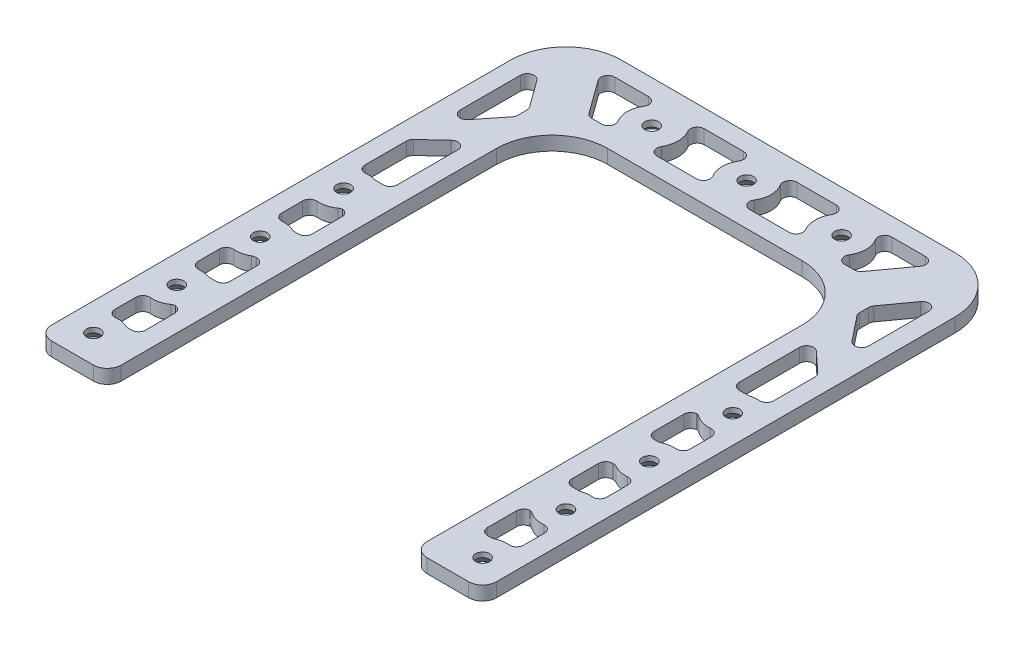
from build123d import *
from OCP.BRepFilletAPI import BRepFilletAPI_MakeChamfer

# Parameters (mm, degrees)
SKETCH1_R            = 3.175
BOSS_EXTRUDE1_DEPTH  = 6.35
SKETCH3_R            = 3.175
CUT_EXTRUDE1_DEPTH   = 6.35
FILLET4_R            = 3.175
FILLET4_OF_MIRROR1_R = 3.175
CHAMFER1_SIZE        = 4.0894
CHAMFER1_SIZE2       = 3.554861186


with BuildPart() as part:
    # Sketch1 → Boss-Extrude1 (new body)
    with BuildSketch(Plane(origin=(0, 0, 0), x_dir=(1, 0, 0), z_dir=(0, 1, 0))):
        with BuildLine():
            Line((-76.2, -114.3), (-95.25, -114.3))
            ThreePointArc((-95.25, -114.3), (-99.740128061, -112.440128061), (-101.6, -107.95))
            Line((-101.6, -107.95), (-101.6, 101.6))
            ThreePointArc((-101.6, 101.6), (-94.160512242, 119.560512242), (-76.2, 127))
            Line((-76.2, 127), (76.2, 127))
            ThreePointArc((76.2, 127), (94.160512242, 119.560512242), (101.6, 101.6))
            Line((101.6, 101.6), (101.6, -107.95))
            ThreePointArc((101.6, -107.95), (99.740128061, -112.440128061), (95.25, -114.3))
            Line((95.25, -114.3), (76.2, -114.3))
            ThreePointArc((76.2, -114.3), (71.709871939, -112.440128061), (69.85, -107.95))
            Line((69.85, -107.95), (69.85, 63.5))
            ThreePointArc((69.85, 63.5), (62.410512242, 81.460512242), (44.45, 88.9))
            Line((44.45, 88.9), (-44.45, 88.9))
            ThreePointArc((-44.45, 88.9), (-62.410512242, 81.460512242), (-69.85, 63.5))
            Line((-69.85, 63.5), (-69.85, -107.95))
            ThreePointArc((-69.85, -107.95), (-71.709871939, -112.440128061), (-76.2, -114.3))
        make_face()
        with Locations(Location((-88.9, -101.6, 0), (0, 0, 270))):
            Circle(SKETCH1_R, mode=Mode.SUBTRACT)
        with Locations(Location((-88.9, -63.5, 0), (0, 0, 270))):
            Circle(SKETCH1_R, mode=Mode.SUBTRACT)
        with Locations(Location((-88.9, -25.4, 0), (0, 0, 270))):
            Circle(SKETCH1_R, mode=Mode.SUBTRACT)
        with Locations(Location((-88.9, 12.7, 0), (0, 0, 270))):
            Circle(SKETCH1_R, mode=Mode.SUBTRACT)
        with Locations(Location((88.9, -101.6, 0), (0, 0, 270))):
            Circle(SKETCH1_R, mode=Mode.SUBTRACT)
        with Locations(Location((88.9, -63.5, 0), (0, 0, 270))):
            Circle(SKETCH1_R, mode=Mode.SUBTRACT)
        with Locations(Location((88.9, -25.4, 0), (0, 0, 270))):
            Circle(SKETCH1_R, mode=Mode.SUBTRACT)
        with Locations(Location((88.9, 12.7, 0), (0, 0, 270))):
            Circle(SKETCH1_R, mode=Mode.SUBTRACT)
    extrude(amount=BOSS_EXTRUDE1_DEPTH)

    # Sketch3 → Cut-Extrude1 (cut)
    with BuildSketch(Plane(origin=(0, 6.35, 0), x_dir=(1, 0, 0), z_dir=(0, 1, 0))):
        with Locations(Location((43.375353707, 107.95, 0), (0, 0, 270))):
            Circle(SKETCH3_R)
        with Locations(Location((0, 107.95, 0), (0, 0, 270))):
            Circle(SKETCH3_R)
        with BuildLine():
            Line((78.105, 23.258336745), (78.105, 61.340531918))
            Line((78.105, 61.340531918), (93.345, 47.170067796))
            Line((93.345, 47.170067796), (93.345, 22.884774482))
            ThreePointArc((93.345, 22.884774482), (89.424192912, 23.800129641), (85.434573413, 23.258336745))
            Line((85.434573413, 23.258336745), (78.105, 23.258336745))
        make_face()
        with BuildLine():
            Line((77.259672654, 118.745), (61.591199198, 97.155))
            Line((61.591199198, 97.155), (46.268613287, 97.155))
            ThreePointArc((46.268613287, 97.155), (54.551353707, 107.95), (46.268613287, 118.745))
            Line((46.268613287, 118.745), (77.259672654, 118.745))
        make_face()
        Polygon((93.345, 107.656756033), (78.105, 86.657160832), (78.105, 80.390531918), (93.345, 61.340531918), align=None)
        with BuildLine():
            Line((37.959659881, 118.745), (2.89325958, 118.745))
            ThreePointArc((2.89325958, 118.745), (11.176, 107.95), (2.89325958, 97.155))
            Line((2.89325958, 97.155), (37.959659881, 97.155))
            ThreePointArc((37.959659881, 97.155), (31.298029309, 107.95), (37.959659881, 118.745))
        make_face()
        with BuildLine():
            Line((78.105, 4.317675942), (78.105, -15.63042915))
            Line((78.105, -15.63042915), (83.604422444, -15.63042915))
            ThreePointArc((83.604422444, -15.63042915), (88.426746306, -14.297581921), (93.345, -15.215225518))
            Line((93.345, -15.215225518), (93.345, 2.515225518))
            ThreePointArc((93.345, 2.515225518), (87.21371935, 1.716188557), (81.604501413, 4.317675942))
            Line((81.604501413, 4.317675942), (78.105, 4.317675942))
        make_face()
        with BuildLine():
            Line((93.345, -35.584774482), (93.345, -53.315225518))
            ThreePointArc((93.345, -53.315225518), (89.184741981, -52.391148653), (84.982606187, -53.100880712))
            Line((84.982606187, -53.100880712), (78.105, -53.100880712))
            Line((78.105, -53.100880712), (78.105, -34.571089953))
            Line((78.105, -34.571089953), (82.62474978, -34.571089953))
            ThreePointArc((82.62474978, -34.571089953), (87.853891474, -36.463151143), (93.345, -35.584774482))
        make_face()
        with BuildLine():
            Line((81.791573677, -72.041541515), (78.105, -72.041541515))
            Line((78.105, -72.041541515), (78.105, -91.738428923))
            Line((78.105, -91.738428923), (83.641445836, -91.738428923))
            ThreePointArc((83.641445836, -91.738428923), (88.448367548, -90.43312917), (93.345, -91.345978789))
            Line((93.345, -91.345978789), (93.345, -73.684774482))
            ThreePointArc((93.345, -73.684774482), (87.335227304, -74.501779068), (81.791573677, -72.041541515))
        make_face()
    cut_extrude1 = extrude(amount=-CUT_EXTRUDE1_DEPTH, mode=Mode.SUBTRACT)

    # Fillet4
    # the kernel refuses this fillet: 3.175 mm, written as the material it adds along each edge
    with BuildSketch(Plane(origin=(93.345, 6.35, -107.656756033), x_dir=(0, 0, 1), z_dir=(0, -1, 0))) as fillet4_piece_1:
        with BuildLine():
            CenterArc((FILLET4_R * 3.08047739676, FILLET4_R), FILLET4_R, 125.969453218, 144.030546782)
            Line((FILLET4_R * 2.49312354886, FILLET4_R * 1.80933025235), (0, 0))
            Line((0, 0), (FILLET4_R * 3.08047739676, 0))
        make_face()
    extrude(amount=6.35)
    with BuildSketch(Plane(origin=(81.791573677, 6.35, 72.041541515), x_dir=(0.7950634404739595, 0, 0.6065262777668505), z_dir=(0, -1, 0))) as fillet4_piece_2:
        with BuildLine():
            CenterArc((1.076526873, 3.172147069), FILLET4_R, 232.661248168, 34.909660196)
            Line((-0.849194059, 0.647820646), (0, 0))
            ThreePointArc((0, 0), (0.470980507, 0.009985257), (0.941961014, 0))
        make_face()
    extrude(amount=6.35)
    with BuildSketch(Plane(origin=(93.345, 6.35, 35.584774482), x_dir=(0, 0, 1), z_dir=(0, -1, 0)), Plane(origin=(93.345, 6.35, -2.515225518), x_dir=(0, 0, 1), z_dir=(0, -1, 0))) as fillet4_piece_3:
        with BuildLine():
            CenterArc((4.046169136, 3.175), FILLET4_R, 174.900311086, 95.099688914)
            ThreePointArc((0.883737221, 3.457222222), (0.581545213, 1.692906894), (0, 0))
            Line((0, 0), (4.046169136, 0))
        make_face()
    extrude(amount=6.35)
    with BuildSketch(Plane(origin=(81.604501413, 6.35, -4.317675942), x_dir=(-1, 0, 0), z_dir=(0, -1, 0))) as fillet4_piece_4:
        with BuildLine():
            CenterArc((1.104555988, -3.175), FILLET4_R, 90, 36.010275214)
            ThreePointArc((-0.762122806, -0.606705765), (-0.374410194, -0.311707901), (0, 0))
            Line((0, 0), (1.104555988, 0))
        make_face()
    extrude(amount=6.35)
    with BuildSketch(Plane(origin=(78.105, 6.35, -4.317675942), x_dir=(0, 0, 1), z_dir=(0, -1, 0)), Plane(origin=(78.105, 6.35, 34.571089953), x_dir=(0, 0, 1), z_dir=(0, -1, 0)), Plane(origin=(78.105, 6.35, 53.100880712), x_dir=(1, 0, 0), z_dir=(0, -1, 0)), Plane(origin=(78.105, 6.35, 15.63042915), x_dir=(1, 0, 0), z_dir=(0, -1, 0)), Plane(origin=(78.105, 6.35, 91.738428923), x_dir=(1, 0, 0), z_dir=(0, -1, 0)), Plane(origin=(78.105, 6.35, 72.041541515), x_dir=(0, 0, 1), z_dir=(0, -1, 0))) as fillet4_piece_5:
        with BuildLine():
            CenterArc((FILLET4_R, -FILLET4_R), FILLET4_R, 90, 90)
            Line((0, -FILLET4_R), (0, 0))
            Line((0, 0), (FILLET4_R, 0))
        make_face()
    extrude(amount=6.35)
    with BuildSketch(Plane(origin=(82.62474978, 6.35, 34.571089953), x_dir=(-1, 0, 0), z_dir=(0, -1, 0))) as fillet4_piece_6:
        with BuildLine():
            CenterArc((0.915488207, -3.175), FILLET4_R, 90, 30.21782343)
            ThreePointArc((-0.682453666, -0.431424455), (-0.337307367, -0.221912279), (0, 0))
            Line((0, 0), (0.915488207, 0))
        make_face()
    extrude(amount=6.35)
    with BuildSketch(Plane(origin=(93.345, 6.35, 53.315225518), x_dir=(0, 0, -1), z_dir=(0, -1, 0)), Plane(origin=(93.345, 6.35, 15.215225518), x_dir=(0, 0, -1), z_dir=(0, -1, 0)), Plane(origin=(93.345, 6.35, -22.884774482), x_dir=(0, 0, -1), z_dir=(0, -1, 0))) as fillet4_piece_7:
        with BuildLine():
            CenterArc((4.046169136, -3.175), FILLET4_R, 90, 95.099688914)
            ThreePointArc((0.883737221, -3.457222222), (0.581545213, -1.692906894), (0, 0))
            Line((0, 0), (4.046169136, 0))
        make_face()
    extrude(amount=6.35)
    with BuildSketch(Plane(origin=(93.345, 6.35, -61.340531918), x_dir=(0, 0, -1), z_dir=(0, -1, 0))) as fillet4_piece_8:
        with BuildLine():
            CenterArc((FILLET4_R * 2.85078105936, -FILLET4_R), FILLET4_R, 90, 141.340191746)
            Line((FILLET4_R * 2.2260860118, -FILLET4_R * 1.78086880944), (0, 0))
            Line((0, 0), (FILLET4_R * 2.85078105936, 0))
        make_face()
    extrude(amount=6.35)
    with BuildSketch(Plane(origin=(84.982606187, 6.35, 53.100880712), x_dir=(0.9431539105174358, 0, -0.3323562863489553), z_dir=(0, -1, 0))) as fillet4_piece_9:
        with BuildLine():
            CenterArc((0.545126003, -3.174268709), FILLET4_R, 91.229756593, 18.182098439)
            Line((-0.510105206, -0.179755043), (0, 0))
            ThreePointArc((0, 0), (0.238492626, -0.002559518), (0.476985252, 0))
        make_face()
    extrude(amount=6.35)
    with BuildSketch(Plane(origin=(83.604422444, 6.35, 15.63042915), x_dir=(0.8929765434620884, 0, -0.4501032024175135), z_dir=(0, -1, 0))) as fillet4_piece_10:
        with BuildLine():
            CenterArc((0.757740379, -3.173586864), FILLET4_R, 91.709518425, 25.040787078)
            Line((-0.671337288, -0.338386339), (0, 0))
            ThreePointArc((0, 0), (0.331511416, -0.004945974), (0.663022832, 0))
        make_face()
    extrude(amount=6.35)
    with BuildSketch(Plane(origin=(85.434573413, 6.35, -23.258336745), x_dir=(0.9558423918856299, 0, -0.2938797745241371), z_dir=(0, -1, 0))) as fillet4_piece_11:
        with BuildLine():
            CenterArc((0.478902893, -3.174435609), FILLET4_R, 91.080344117, 16.010031791)
            Line((-0.454165391, -0.139636015), (0, 0))
            ThreePointArc((0, 0), (0.209520016, -0.001975367), (0.419040032, 0))
        make_face()
    extrude(amount=6.35)
    with BuildSketch(Plane(origin=(78.105, 6.35, -80.390531918), x_dir=(0.6246950475544321, 0, 0.7808688094430242), z_dir=(0, -1, 0))) as fillet4_piece_12:
        with BuildLine():
            CenterArc((FILLET4_R * 0.350781059358, -FILLET4_R), FILLET4_R, 90, 38.659808254)
            Line((-FILLET4_R * 0.273913988196, -FILLET4_R * 0.219131190557), (0, 0))
            Line((0, 0), (FILLET4_R * 0.350781059358, 0))
        make_face()
    extrude(amount=6.35)
    with BuildSketch(Plane(origin=(78.105, 6.35, -86.657160832), x_dir=(0, 0, 1), z_dir=(0, -1, 0))) as fillet4_piece_13:
        with BuildLine():
            CenterArc((FILLET4_R * 0.324625008141, -FILLET4_R), FILLET4_R, 90, 35.969453218)
            Line((-FILLET4_R * 0.262728839756, -FILLET4_R * 0.190669747655), (0, 0))
            Line((0, 0), (FILLET4_R * 0.324625008141, 0))
        make_face()
    extrude(amount=6.35)
    with BuildSketch(Plane(origin=(83.641445836, 6.35, 91.738428923), x_dir=(0.8957821942438247, 0, -0.44449326257629435), z_dir=(0, -1, 0))) as fillet4_piece_14:
        with BuildLine():
            CenterArc((0.747165618, -3.17363968), FILLET4_R, 91.677265305, 24.713657106)
            Line((-0.66410049, -0.329531214), (0, 0))
            ThreePointArc((0, 0), (0.327117286, -0.004788325), (0.654234571, 0))
        make_face()
    extrude(amount=6.35)
    with BuildSketch(Plane(origin=(93.345, 6.35, 91.345978789), x_dir=(0, 0, -1), z_dir=(0, -1, 0))) as fillet4_piece_15:
        with BuildLine():
            CenterArc((4.040673644, -3.175), FILLET4_R, 90, 95.07706454)
            ThreePointArc((0.878130534, -3.455973451), (0.577785497, -1.692739213), (0, 0))
            Line((0, 0), (4.040673644, 0))
        make_face()
    extrude(amount=6.35)
    with BuildSketch(Plane(origin=(93.345, 6.35, 73.684774482), x_dir=(-0.9688476666359841, 0, 0.24765742236809546), z_dir=(0, -1, 0))) as fillet4_piece_16:
        with BuildLine():
            CenterArc((4.07815516, -3.13380921), FILLET4_R, 99.239244782, 95.099688914)
            Line((1.002063819, -3.920121526), (0, 0))
            ThreePointArc((0, 0), (1.784192883, -0.144167765), (3.568385765, 0))
        make_face()
    extrude(amount=6.35)
    with BuildSketch(Plane(origin=(78.105, 6.35, -23.258336745), x_dir=(0, 0, -1), z_dir=(0, -1, 0))) as fillet4_piece_17:
        with BuildLine():
            CenterArc((FILLET4_R, FILLET4_R), FILLET4_R, 180, 90)
            Line((0, FILLET4_R), (0, 0))
            Line((0, 0), (FILLET4_R, 0))
        make_face()
    extrude(amount=6.35)
    with BuildSketch(Plane(origin=(78.105, 6.35, -61.340531918), x_dir=(0, 0, 1), z_dir=(0, -1, 0))) as fillet4_piece_18:
        with BuildLine():
            CenterArc((FILLET4_R * 2.29531164698, -FILLET4_R), FILLET4_R, 90, 132.917309318)
            Line((FILLET4_R * 1.56297443052, -FILLET4_R * 1.68094214246), (0, 0))
            Line((0, 0), (FILLET4_R * 2.29531164698, 0))
        make_face()
    extrude(amount=6.35)
    with BuildSketch(Plane(origin=(93.345, 6.35, -47.170067796), x_dir=(-0.7323372164626286, 0, -0.6809421424642251), z_dir=(0, -1, 0))) as fillet4_piece_19:
        with BuildLine():
            CenterArc((FILLET4_R * 0.435670686077, -FILLET4_R), FILLET4_R, 90, 47.082690682)
            Line((-FILLET4_R * 0.296666530386, -FILLET4_R * 0.319057857536), (0, 0))
            Line((0, 0), (FILLET4_R * 0.435670686077, 0))
        make_face()
    extrude(amount=6.35)
    with BuildSketch(Plane(origin=(77.259672654, 6.35, -118.745), x_dir=(-1, 0, 0), z_dir=(0, -1, 0))) as fillet4_piece_20:
        with BuildLine():
            CenterArc((FILLET4_R * 1.96131782211, -FILLET4_R), FILLET4_R, 90, 125.969453218)
            Line((FILLET4_R * 1.15198756976, -FILLET4_R * 1.5873538479), (0, 0))
            Line((0, 0), (FILLET4_R * 1.96131782211, 0))
        make_face()
    extrude(amount=6.35)
    with BuildSketch(Plane(origin=(46.268613287, 6.35, -97.155), x_dir=(1, 0, 0), z_dir=(0, -1, 0))) as fillet4_piece_21:
        with BuildLine():
            CenterArc((9.26761214, -3.175), FILLET4_R, 90, 122.071250633)
            ThreePointArc((6.577153795, -4.860840708), (3.749183143, -1.807178759), (0, 0))
            Line((0, 0), (9.26761214, 0))
        make_face()
    extrude(amount=6.35)
    with BuildSketch(Plane(origin=(46.268613287, 6.35, -118.745), x_dir=(1, 0, 0), z_dir=(0, -1, 0))) as fillet4_piece_22:
        with BuildLine():
            CenterArc((9.26761214, 3.175), FILLET4_R, 147.928749367, 122.071250633)
            ThreePointArc((6.577153795, 4.860840708), (3.749183143, 1.807178759), (0, 0))
            Line((0, 0), (9.26761214, 0))
        make_face()
    extrude(amount=6.35)
    with BuildSketch(Plane(origin=(61.591199198, 6.35, -97.155), x_dir=(0.5873538478967152, 0, -0.8093302523450625), z_dir=(0, -1, 0))) as fillet4_piece_23:
        with BuildLine():
            CenterArc((FILLET4_R * 0.509861272216, -FILLET4_R), FILLET4_R, 90, 54.030546782)
            Line((-FILLET4_R * 0.299468980129, -FILLET4_R * 0.412646152103), (0, 0))
            Line((0, 0), (FILLET4_R * 0.509861272216, 0))
        make_face()
    extrude(amount=6.35)
    with BuildSketch(Plane(origin=(37.959659881, 6.35, -118.745), x_dir=(-1, 0, 0), z_dir=(0, -1, 0))) as fillet4_piece_24:
        with BuildLine():
            CenterArc((7.796762401, -3.175), FILLET4_R, 90, 119.973274045)
            ThreePointArc((5.046391544, -4.761217246), (2.872446223, -2.010439729), (0, 0))
            Line((0, 0), (7.796762401, 0))
        make_face()
    extrude(amount=6.35)
    with BuildSketch(Plane(origin=(37.959659881, 6.35, -97.155), x_dir=(-0.7273598009961122, 0, -0.6862563077268551), z_dir=(0, -1, 0))) as fillet4_piece_25:
        with BuildLine():
            CenterArc((7.849915325, -3.041210009), FILLET4_R, 106.692237055, 119.973274045)
            Line((5.671051548, -5.350577377), (0, 0))
            ThreePointArc((0, 0), (3.468978858, -0.508921298), (6.937957717, 0))
        make_face()
    extrude(amount=6.35)
    with BuildSketch(Plane(origin=(2.89325958, 6.35, -97.155), x_dir=(0.8042073408405346, 0, -0.5943488478479587), z_dir=(0, -1, 0))) as fillet4_piece_26:
        with BuildLine():
            CenterArc((9.340139307, 2.95483629), FILLET4_R, 126.466226848, 122.071250633)
            Line((7.453081715, 5.508194598), (0, 0))
            ThreePointArc((0, 0), (4.089215219, 0.774976257), (8.178430438, 0))
        make_face()
    extrude(amount=6.35)
    with BuildSketch(Plane(origin=(2.89325958, 6.35, -118.745), x_dir=(0.8042073408405344, 0, 0.594348847847959), z_dir=(0, -1, 0))) as fillet4_piece_27:
        with BuildLine():
            CenterArc((9.340139307, -2.95483629), FILLET4_R, 111.462522519, 122.071250633)
            Line((7.453081715, -5.508194598), (0, 0))
            ThreePointArc((0, 0), (4.089215219, -0.774976257), (8.178430438, 0))
        make_face()
    extrude(amount=6.35)

    # Mirror1: Cut-Extrude1 across plane
    add(cut_extrude1.mirror(Plane(origin=(0, 0, 0), x_dir=(0, 0, 1), z_dir=(1, 0, 0))), mode=Mode.SUBTRACT)

    # Fillet4 of Mirror1
    # the kernel refuses this fillet: 3.175 mm, written as the material it adds along each edge
    with BuildSketch(Plane(origin=(-93.345, 6.35, -107.656756033), x_dir=(0, 0, 1), z_dir=(0, -1, 0))) as fillet4_of_mirror1_piece_1:
        with BuildLine():
            CenterArc((FILLET4_OF_MIRROR1_R * 3.08047739676, -FILLET4_OF_MIRROR1_R), FILLET4_OF_MIRROR1_R, 90, 144.030546782)
            Line((FILLET4_OF_MIRROR1_R * 2.49312354886, -FILLET4_OF_MIRROR1_R * 1.80933025235), (0, 0))
            Line((0, 0), (FILLET4_OF_MIRROR1_R * 3.08047739676, 0))
        make_face()
    extrude(amount=6.35)
    with BuildSketch(Plane(origin=(-81.791573677, 6.35, 72.041541515), x_dir=(-0.7950634404739595, 0, 0.6065262777668505), z_dir=(0, -1, 0))) as fillet4_of_mirror1_piece_2:
        with BuildLine():
            CenterArc((1.076526873, -3.172147069), FILLET4_OF_MIRROR1_R, 92.429091636, 34.909660196)
            Line((-0.849194059, -0.647820646), (0, 0))
            ThreePointArc((0, 0), (0.470980507, -0.009985257), (0.941961014, 0))
        make_face()
    extrude(amount=6.35)
    with BuildSketch(Plane(origin=(-93.345, 6.35, 35.584774482), x_dir=(0, 0, 1), z_dir=(0, -1, 0)), Plane(origin=(-93.345, 6.35, -2.515225518), x_dir=(0, 0, 1), z_dir=(0, -1, 0))) as fillet4_of_mirror1_piece_3:
        with BuildLine():
            CenterArc((4.046169136, -3.175), FILLET4_OF_MIRROR1_R, 90, 95.099688914)
            ThreePointArc((0.883737221, -3.457222222), (0.581545213, -1.692906894), (0, 0))
            Line((0, 0), (4.046169136, 0))
        make_face()
    extrude(amount=6.35)
    with BuildSketch(Plane(origin=(-81.604501413, 6.35, -4.317675942), x_dir=(1, 0, 0), z_dir=(0, -1, 0))) as fillet4_of_mirror1_piece_4:
        with BuildLine():
            CenterArc((1.104555988, 3.175), FILLET4_OF_MIRROR1_R, 233.989724786, 36.010275214)
            ThreePointArc((-0.762122806, 0.606705765), (-0.374410194, 0.311707901), (0, 0))
            Line((0, 0), (1.104555988, 0))
        make_face()
    extrude(amount=6.35)
    with BuildSketch(Plane(origin=(-78.105, 6.35, -4.317675942), x_dir=(0, 0, 1), z_dir=(0, -1, 0)), Plane(origin=(-78.105, 6.35, 34.571089953), x_dir=(0, 0, 1), z_dir=(0, -1, 0)), Plane(origin=(-78.105, 6.35, 53.100880712), x_dir=(-1, 0, 0), z_dir=(0, -1, 0)), Plane(origin=(-78.105, 6.35, 15.63042915), x_dir=(-1, 0, 0), z_dir=(0, -1, 0)), Plane(origin=(-78.105, 6.35, 91.738428923), x_dir=(-1, 0, 0), z_dir=(0, -1, 0)), Plane(origin=(-78.105, 6.35, 72.041541515), x_dir=(0, 0, 1), z_dir=(0, -1, 0))) as fillet4_of_mirror1_piece_5:
        with BuildLine():
            CenterArc((FILLET4_OF_MIRROR1_R, FILLET4_OF_MIRROR1_R), FILLET4_OF_MIRROR1_R, 180, 90)
            Line((0, FILLET4_OF_MIRROR1_R), (0, 0))
            Line((0, 0), (FILLET4_OF_MIRROR1_R, 0))
        make_face()
    extrude(amount=6.35)
    with BuildSketch(Plane(origin=(-82.62474978, 6.35, 34.571089953), x_dir=(1, 0, 0), z_dir=(0, -1, 0))) as fillet4_of_mirror1_piece_6:
        with BuildLine():
            CenterArc((0.915488207, 3.175), FILLET4_OF_MIRROR1_R, 239.78217657, 30.21782343)
            ThreePointArc((-0.682453666, 0.431424455), (-0.337307367, 0.221912279), (0, 0))
            Line((0, 0), (0.915488207, 0))
        make_face()
    extrude(amount=6.35)
    with BuildSketch(Plane(origin=(-93.345, 6.35, 53.315225518), x_dir=(0, 0, -1), z_dir=(0, -1, 0)), Plane(origin=(-93.345, 6.35, 15.215225518), x_dir=(0, 0, -1), z_dir=(0, -1, 0)), Plane(origin=(-93.345, 6.35, -22.884774482), x_dir=(0, 0, -1), z_dir=(0, -1, 0))) as fillet4_of_mirror1_piece_7:
        with BuildLine():
            CenterArc((4.046169136, 3.175), FILLET4_OF_MIRROR1_R, 174.900311086, 95.099688914)
            ThreePointArc((0.883737221, 3.457222222), (0.581545213, 1.692906894), (0, 0))
            Line((0, 0), (4.046169136, 0))
        make_face()
    extrude(amount=6.35)
    with BuildSketch(Plane(origin=(-93.345, 6.35, -61.340531918), x_dir=(0, 0, -1), z_dir=(0, -1, 0))) as fillet4_of_mirror1_piece_8:
        with BuildLine():
            CenterArc((FILLET4_OF_MIRROR1_R * 2.85078105936, FILLET4_OF_MIRROR1_R), FILLET4_OF_MIRROR1_R, 128.659808254, 141.340191746)
            Line((FILLET4_OF_MIRROR1_R * 2.2260860118, FILLET4_OF_MIRROR1_R * 1.78086880944), (0, 0))
            Line((0, 0), (FILLET4_OF_MIRROR1_R * 2.85078105936, 0))
        make_face()
    extrude(amount=6.35)
    with BuildSketch(Plane(origin=(-84.982606187, 6.35, 53.100880712), x_dir=(-0.9431539105174358, 0, -0.3323562863489553), z_dir=(0, -1, 0))) as fillet4_of_mirror1_piece_9:
        with BuildLine():
            CenterArc((0.545126003, 3.174268709), FILLET4_OF_MIRROR1_R, 250.588144968, 18.182098439)
            Line((-0.510105206, 0.179755043), (0, 0))
            ThreePointArc((0, 0), (0.238492626, 0.002559518), (0.476985252, 0))
        make_face()
    extrude(amount=6.35)
    with BuildSketch(Plane(origin=(-83.604422444, 6.35, 15.63042915), x_dir=(-0.8929765434620884, 0, -0.4501032024175135), z_dir=(0, -1, 0))) as fillet4_of_mirror1_piece_10:
        with BuildLine():
            CenterArc((0.757740379, 3.173586864), FILLET4_OF_MIRROR1_R, 243.249694497, 25.040787078)
            Line((-0.671337288, 0.338386339), (0, 0))
            ThreePointArc((0, 0), (0.331511416, 0.004945974), (0.663022832, 0))
        make_face()
    extrude(amount=6.35)
    with BuildSketch(Plane(origin=(-85.434573413, 6.35, -23.258336745), x_dir=(-0.9558423918856299, 0, -0.2938797745241371), z_dir=(0, -1, 0))) as fillet4_of_mirror1_piece_11:
        with BuildLine():
            CenterArc((0.478902893, 3.174435609), FILLET4_OF_MIRROR1_R, 252.909624092, 16.010031791)
            Line((-0.454165391, 0.139636015), (0, 0))
            ThreePointArc((0, 0), (0.209520016, 0.001975367), (0.419040032, 0))
        make_face()
    extrude(amount=6.35)
    with BuildSketch(Plane(origin=(-78.105, 6.35, -80.390531918), x_dir=(-0.6246950475544321, 0, 0.7808688094430242), z_dir=(0, -1, 0))) as fillet4_of_mirror1_piece_12:
        with BuildLine():
            CenterArc((FILLET4_OF_MIRROR1_R * 0.350781059358, FILLET4_OF_MIRROR1_R), FILLET4_OF_MIRROR1_R, 231.340191746, 38.659808254)
            Line((-FILLET4_OF_MIRROR1_R * 0.273913988196, FILLET4_OF_MIRROR1_R * 0.219131190557), (0, 0))
            Line((0, 0), (FILLET4_OF_MIRROR1_R * 0.350781059358, 0))
        make_face()
    extrude(amount=6.35)
    with BuildSketch(Plane(origin=(-78.105, 6.35, -86.657160832), x_dir=(0, 0, 1), z_dir=(0, -1, 0))) as fillet4_of_mirror1_piece_13:
        with BuildLine():
            CenterArc((FILLET4_OF_MIRROR1_R * 0.324625008141, FILLET4_OF_MIRROR1_R), FILLET4_OF_MIRROR1_R, 234.030546782, 35.969453218)
            Line((-FILLET4_OF_MIRROR1_R * 0.262728839756, FILLET4_OF_MIRROR1_R * 0.190669747655), (0, 0))
            Line((0, 0), (FILLET4_OF_MIRROR1_R * 0.324625008141, 0))
        make_face()
    extrude(amount=6.35)
    with BuildSketch(Plane(origin=(-83.641445836, 6.35, 91.738428923), x_dir=(-0.8957821942438247, 0, -0.44449326257629435), z_dir=(0, -1, 0))) as fillet4_of_mirror1_piece_14:
        with BuildLine():
            CenterArc((0.747165618, 3.17363968), FILLET4_OF_MIRROR1_R, 243.609077589, 24.713657106)
            Line((-0.66410049, 0.329531214), (0, 0))
            ThreePointArc((0, 0), (0.327117286, 0.004788325), (0.654234571, 0))
        make_face()
    extrude(amount=6.35)
    with BuildSketch(Plane(origin=(-93.345, 6.35, 91.345978789), x_dir=(0, 0, -1), z_dir=(0, -1, 0))) as fillet4_of_mirror1_piece_15:
        with BuildLine():
            CenterArc((4.040673644, 3.175), FILLET4_OF_MIRROR1_R, 174.92293546, 95.07706454)
            ThreePointArc((0.878130534, 3.455973451), (0.577785497, 1.692739213), (0, 0))
            Line((0, 0), (4.040673644, 0))
        make_face()
    extrude(amount=6.35)
    with BuildSketch(Plane(origin=(-93.345, 6.35, 73.684774482), x_dir=(0.9688476666359841, 0, 0.24765742236809546), z_dir=(0, -1, 0))) as fillet4_of_mirror1_piece_16:
        with BuildLine():
            CenterArc((4.07815516, 3.13380921), FILLET4_OF_MIRROR1_R, 165.661066304, 95.099688914)
            Line((1.002063819, 3.920121526), (0, 0))
            ThreePointArc((0, 0), (1.784192883, 0.144167765), (3.568385765, 0))
        make_face()
    extrude(amount=6.35)
    with BuildSketch(Plane(origin=(-78.105, 6.35, -23.258336745), x_dir=(0, 0, -1), z_dir=(0, -1, 0))) as fillet4_of_mirror1_piece_17:
        with BuildLine():
            CenterArc((FILLET4_OF_MIRROR1_R, -FILLET4_OF_MIRROR1_R), FILLET4_OF_MIRROR1_R, 90, 90)
            Line((0, -FILLET4_OF_MIRROR1_R), (0, 0))
            Line((0, 0), (FILLET4_OF_MIRROR1_R, 0))
        make_face()
    extrude(amount=6.35)
    with BuildSketch(Plane(origin=(-78.105, 6.35, -61.340531918), x_dir=(0, 0, 1), z_dir=(0, -1, 0))) as fillet4_of_mirror1_piece_18:
        with BuildLine():
            CenterArc((FILLET4_OF_MIRROR1_R * 2.29531164698, FILLET4_OF_MIRROR1_R), FILLET4_OF_MIRROR1_R, 137.082690682, 132.917309318)
            Line((FILLET4_OF_MIRROR1_R * 1.56297443052, FILLET4_OF_MIRROR1_R * 1.68094214246), (0, 0))
            Line((0, 0), (FILLET4_OF_MIRROR1_R * 2.29531164698, 0))
        make_face()
    extrude(amount=6.35)
    with BuildSketch(Plane(origin=(-93.345, 6.35, -47.170067796), x_dir=(0.7323372164626286, 0, -0.6809421424642251), z_dir=(0, -1, 0))) as fillet4_of_mirror1_piece_19:
        with BuildLine():
            CenterArc((FILLET4_OF_MIRROR1_R * 0.435670686077, FILLET4_OF_MIRROR1_R), FILLET4_OF_MIRROR1_R, 222.917309318, 47.082690682)
            Line((-FILLET4_OF_MIRROR1_R * 0.296666530386, FILLET4_OF_MIRROR1_R * 0.319057857536), (0, 0))
            Line((0, 0), (FILLET4_OF_MIRROR1_R * 0.435670686077, 0))
        make_face()
    extrude(amount=6.35)
    with BuildSketch(Plane(origin=(-77.259672654, 6.35, -118.745), x_dir=(1, 0, 0), z_dir=(0, -1, 0))) as fillet4_of_mirror1_piece_20:
        with BuildLine():
            CenterArc((FILLET4_OF_MIRROR1_R * 1.96131782211, FILLET4_OF_MIRROR1_R), FILLET4_OF_MIRROR1_R, 144.030546782, 125.969453218)
            Line((FILLET4_OF_MIRROR1_R * 1.15198756976, FILLET4_OF_MIRROR1_R * 1.5873538479), (0, 0))
            Line((0, 0), (FILLET4_OF_MIRROR1_R * 1.96131782211, 0))
        make_face()
    extrude(amount=6.35)
    with BuildSketch(Plane(origin=(-46.268613287, 6.35, -97.155), x_dir=(-1, 0, 0), z_dir=(0, -1, 0))) as fillet4_of_mirror1_piece_21:
        with BuildLine():
            CenterArc((9.26761214, 3.175), FILLET4_OF_MIRROR1_R, 147.928749367, 122.071250633)
            ThreePointArc((6.577153795, 4.860840708), (3.749183143, 1.807178759), (0, 0))
            Line((0, 0), (9.26761214, 0))
        make_face()
    extrude(amount=6.35)
    with BuildSketch(Plane(origin=(-46.268613287, 6.35, -118.745), x_dir=(-1, 0, 0), z_dir=(0, -1, 0))) as fillet4_of_mirror1_piece_22:
        with BuildLine():
            CenterArc((9.26761214, -3.175), FILLET4_OF_MIRROR1_R, 90, 122.071250633)
            ThreePointArc((6.577153795, -4.860840708), (3.749183143, -1.807178759), (0, 0))
            Line((0, 0), (9.26761214, 0))
        make_face()
    extrude(amount=6.35)
    with BuildSketch(Plane(origin=(-61.591199198, 6.35, -97.155), x_dir=(-0.5873538478967152, 0, -0.8093302523450625), z_dir=(0, -1, 0))) as fillet4_of_mirror1_piece_23:
        with BuildLine():
            CenterArc((FILLET4_OF_MIRROR1_R * 0.509861272216, FILLET4_OF_MIRROR1_R), FILLET4_OF_MIRROR1_R, 215.969453218, 54.030546782)
            Line((-FILLET4_OF_MIRROR1_R * 0.299468980129, FILLET4_OF_MIRROR1_R * 0.412646152103), (0, 0))
            Line((0, 0), (FILLET4_OF_MIRROR1_R * 0.509861272216, 0))
        make_face()
    extrude(amount=6.35)
    with BuildSketch(Plane(origin=(-37.959659881, 6.35, -118.745), x_dir=(1, 0, 0), z_dir=(0, -1, 0))) as fillet4_of_mirror1_piece_24:
        with BuildLine():
            CenterArc((7.796762401, 3.175), FILLET4_OF_MIRROR1_R, 150.026725955, 119.973274045)
            ThreePointArc((5.046391544, 4.761217246), (2.872446223, 2.010439729), (0, 0))
            Line((0, 0), (7.796762401, 0))
        make_face()
    extrude(amount=6.35)
    with BuildSketch(Plane(origin=(-37.959659881, 6.35, -97.155), x_dir=(0.7273598009961122, 0, -0.6862563077268551), z_dir=(0, -1, 0))) as fillet4_of_mirror1_piece_25:
        with BuildLine():
            CenterArc((7.849915325, 3.041210009), FILLET4_OF_MIRROR1_R, 133.3344889, 119.973274045)
            Line((5.671051548, 5.350577377), (0, 0))
            ThreePointArc((0, 0), (3.468978858, 0.508921298), (6.937957717, 0))
        make_face()
    extrude(amount=6.35)
    with BuildSketch(Plane(origin=(-2.89325958, 6.35, -97.155), x_dir=(-0.8042073408405346, 0, -0.5943488478479587), z_dir=(0, -1, 0))) as fillet4_of_mirror1_piece_26:
        with BuildLine():
            CenterArc((9.340139307, -2.95483629), FILLET4_OF_MIRROR1_R, 111.462522519, 122.071250633)
            Line((7.453081715, -5.508194598), (0, 0))
            ThreePointArc((0, 0), (4.089215219, -0.774976257), (8.178430438, 0))
        make_face()
    extrude(amount=6.35)
    with BuildSketch(Plane(origin=(-2.89325958, 6.35, -118.745), x_dir=(-0.8042073408405344, 0, 0.594348847847959), z_dir=(0, -1, 0))) as fillet4_of_mirror1_piece_27:
        with BuildLine():
            CenterArc((9.340139307, 2.95483629), FILLET4_OF_MIRROR1_R, 126.466226848, 122.071250633)
            Line((7.453081715, 5.508194598), (0, 0))
            ThreePointArc((0, 0), (4.089215219, 0.774976257), (8.178430438, 0))
        make_face()
    extrude(amount=6.35)

    # Chamfer1: one chamfer whose edges measure the first distance from different faces: ONE call of the kernel's chamfer builder (chamfer() names one face for all edges)
    chamfer1_edges_1 = [part.edges().sort_by_distance(p)[0] for p in [
        (43.375353707, 0, -111.125),
    ]]
    chamfer1_side_1 = [part.faces().sort_by_distance(p)[0] for p in [
        (43.375353707, 3.175, -111.125),
    ]]
    chamfer1_edges_2 = [part.edges().sort_by_distance(p)[0] for p in [
        (0, 0, -111.125),
    ]]
    chamfer1_side_2 = [part.faces().sort_by_distance(p)[0] for p in [
        (0, 3.175, -111.125),
    ]]
    chamfer1_edges_3 = [part.edges().sort_by_distance(p)[0] for p in [
        (-88.9, 0, 98.425),
    ]]
    chamfer1_side_3 = [part.faces().sort_by_distance(p)[0] for p in [
        (-88.9, 3.175, 98.425),
    ]]
    chamfer1_edges_4 = [part.edges().sort_by_distance(p)[0] for p in [
        (-88.9, 0, 60.325),
    ]]
    chamfer1_side_4 = [part.faces().sort_by_distance(p)[0] for p in [
        (-88.9, 3.175, 60.325),
    ]]
    chamfer1_edges_5 = [part.edges().sort_by_distance(p)[0] for p in [
        (-43.375353707, 0, -111.125),
    ]]
    chamfer1_side_5 = [part.faces().sort_by_distance(p)[0] for p in [
        (-6.622959134, 0, -118.635215264),
    ]]
    chamfer1_edges_6 = [part.edges().sort_by_distance(p)[0] for p in [
        (-88.9, 0, 22.225),
    ]]
    chamfer1_side_6 = [part.faces().sort_by_distance(p)[0] for p in [
        (-88.9, 3.175, 22.225),
    ]]
    chamfer1_edges_7 = [part.edges().sort_by_distance(p)[0] for p in [
        (-88.9, 0, -15.875),
    ]]
    chamfer1_side_7 = [part.faces().sort_by_distance(p)[0] for p in [
        (-88.9, 3.175, -15.875),
    ]]
    chamfer1_edges_8 = [part.edges().sort_by_distance(p)[0] for p in [
        (88.9, 0, 98.425),
    ]]
    chamfer1_side_8 = [part.faces().sort_by_distance(p)[0] for p in [
        (88.9, 3.175, 98.425),
    ]]
    chamfer1_edges_9 = [part.edges().sort_by_distance(p)[0] for p in [
        (88.9, 0, 60.325),
    ]]
    chamfer1_side_9 = [part.faces().sort_by_distance(p)[0] for p in [
        (88.9, 3.175, 60.325),
    ]]
    chamfer1_edges_10 = [part.edges().sort_by_distance(p)[0] for p in [
        (88.9, 0, 22.225),
    ]]
    chamfer1_side_10 = [part.faces().sort_by_distance(p)[0] for p in [
        (88.9, 3.175, 22.225),
    ]]
    chamfer1_edges_11 = [part.edges().sort_by_distance(p)[0] for p in [
        (88.9, 0, -15.875),
    ]]
    chamfer1_side_11 = [part.faces().sort_by_distance(p)[0] for p in [
        (88.9, 3.175, -15.875),
    ]]
    chamfer1 = BRepFilletAPI_MakeChamfer(part.part.solid().wrapped)
    for e in chamfer1_edges_1:
        chamfer1.Add(CHAMFER1_SIZE, CHAMFER1_SIZE2, e.wrapped, chamfer1_side_1[0].wrapped)  # the first distance lies on this face
    for e in chamfer1_edges_2:
        chamfer1.Add(CHAMFER1_SIZE, CHAMFER1_SIZE2, e.wrapped, chamfer1_side_2[0].wrapped)  # the first distance lies on this face
    for e in chamfer1_edges_3:
        chamfer1.Add(CHAMFER1_SIZE, CHAMFER1_SIZE2, e.wrapped, chamfer1_side_3[0].wrapped)  # the first distance lies on this face
    for e in chamfer1_edges_4:
        chamfer1.Add(CHAMFER1_SIZE, CHAMFER1_SIZE2, e.wrapped, chamfer1_side_4[0].wrapped)  # the first distance lies on this face
    for e in chamfer1_edges_5:
        chamfer1.Add(CHAMFER1_SIZE, CHAMFER1_SIZE2, e.wrapped, chamfer1_side_5[0].wrapped)  # the first distance lies on this face
    for e in chamfer1_edges_6:
        chamfer1.Add(CHAMFER1_SIZE, CHAMFER1_SIZE2, e.wrapped, chamfer1_side_6[0].wrapped)  # the first distance lies on this face
    for e in chamfer1_edges_7:
        chamfer1.Add(CHAMFER1_SIZE, CHAMFER1_SIZE2, e.wrapped, chamfer1_side_7[0].wrapped)  # the first distance lies on this face
    for e in chamfer1_edges_8:
        chamfer1.Add(CHAMFER1_SIZE, CHAMFER1_SIZE2, e.wrapped, chamfer1_side_8[0].wrapped)  # the first distance lies on this face
    for e in chamfer1_edges_9:
        chamfer1.Add(CHAMFER1_SIZE, CHAMFER1_SIZE2, e.wrapped, chamfer1_side_9[0].wrapped)  # the first distance lies on this face
    for e in chamfer1_edges_10:
        chamfer1.Add(CHAMFER1_SIZE, CHAMFER1_SIZE2, e.wrapped, chamfer1_side_10[0].wrapped)  # the first distance lies on this face
    for e in chamfer1_edges_11:
        chamfer1.Add(CHAMFER1_SIZE, CHAMFER1_SIZE2, e.wrapped, chamfer1_side_11[0].wrapped)  # the first distance lies on this face
    add(Compound.cast(chamfer1.Shape()), mode=Mode.REPLACE)


solid = part.part
